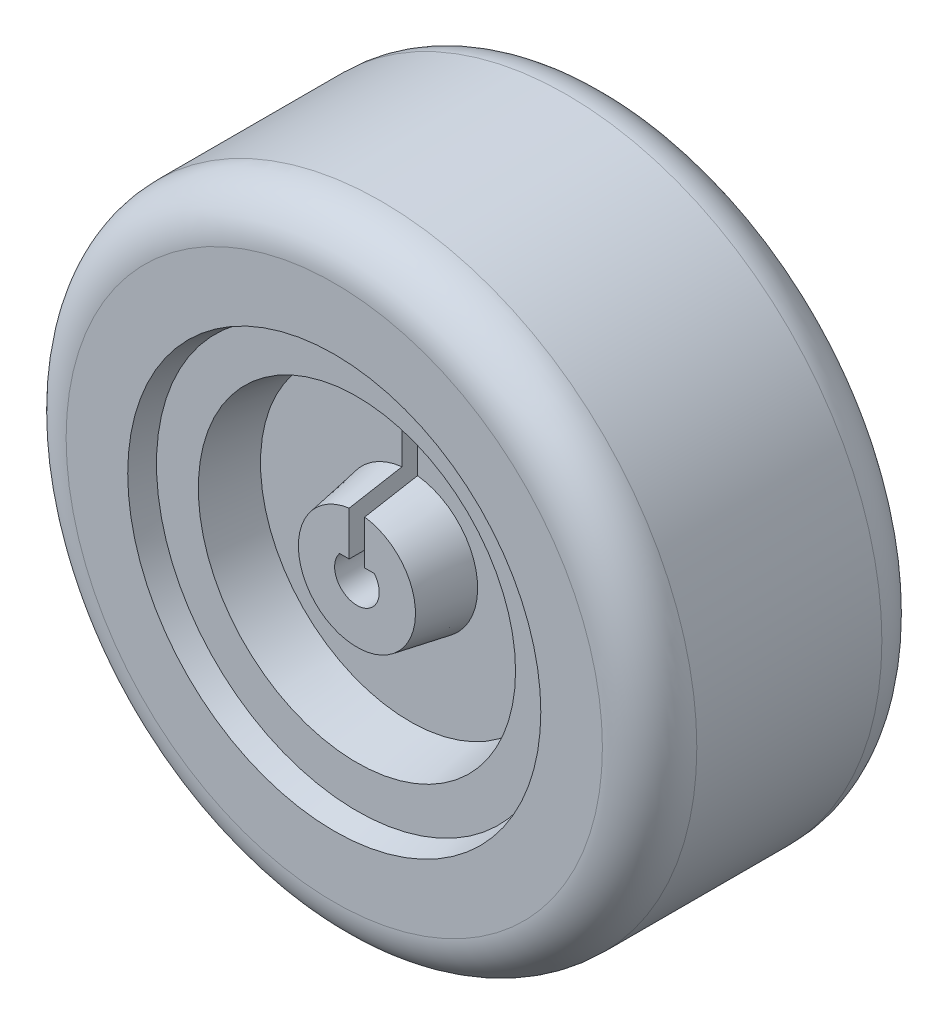
from build123d import *

# Parameters (mm, degrees)
SKETCH1_R           = 21.209
SKETCH1_R_2         = 13.208
BOSS_EXTRUDE1_DEPTH = 18.796
FILLET1_R           = 3.175
BOSS_EXTRUDE2_START = -1.524
SKETCH2_R           = 13.208
BOSS_EXTRUDE2_DEPTH = 15.748
SKETCH4_R           = 10.668
SKETCH4_R_2         = 3.937
CUT_EXTRUDE2_DEPTH  = 3.556
CUT_EXTRUDE2_DRAFT  = -10
SKETCH5_R           = 10.668
CUT_EXTRUDE3_DEPTH  = 9.652
SKETCH6_R           = 4.1275
BOSS_EXTRUDE3_DEPTH = 3.81
BOSS_EXTRUDE3_TAPER = 10
CUT_EXTRUDE1_DEPTH  = 20.32
CHAMFER2_SIZE       = 0.683442603
CHAMFER2_SIZE_2     = 2.54
CHAMFER3_SIZE       = 0.683442603
CHAMFER3_SIZE_2     = 2.54
CUT_EXTRUDE4_DEPTH  = 5.842


with BuildPart() as part:
    # Sketch1 → Boss-Extrude1 (new body)
    with BuildSketch(Plane.XY):
        Circle(SKETCH1_R)
        Circle(SKETCH1_R_2, mode=Mode.SUBTRACT)
    extrude(amount=BOSS_EXTRUDE1_DEPTH)

    # Fillet1
    fillet1_edges = [part.edges().sort_by_distance(p)[0] for p in [
        (-21.209, 0, 0),
        (-21.209, 0, 18.796),
    ]]
    fillet(fillet1_edges, radius=FILLET1_R)



with BuildPart() as body_2:
    # Sketch2 → Boss-Extrude2 (new body)
    with BuildSketch(Plane.XY.offset(18.796).offset(BOSS_EXTRUDE2_START)):
        Circle(SKETCH2_R)
    extrude(amount=-BOSS_EXTRUDE2_DEPTH)


with BuildPart() as cut_extrude2_tool:
    # Sketch4 → Cut-Extrude2 (with draft: the straight prism first)
    with BuildSketch(Plane.XY.offset(17.272)):
        Circle(SKETCH4_R)
        Circle(SKETCH4_R_2, mode=Mode.SUBTRACT)
    extrude(amount=-CUT_EXTRUDE2_DEPTH)
    # Cut-Extrude2: the draft: its side faces are tilted about the plane it starts from
    cut_extrude2_sides = [cut_extrude2_tool.faces().sort_by_distance(p)[0] for p in [
        (-10.668, 0, 15.494),
        (-3.937, 0, 15.494),
    ]]
    draft(cut_extrude2_sides, Plane.XY.offset(17.272), CUT_EXTRUDE2_DRAFT)


with BuildPart() as body_2_1:
    add(body_2.part)

    # Cut-Extrude2: cut by cut_extrude2_tool
    add(cut_extrude2_tool.part, mode=Mode.SUBTRACT)

    # Sketch5 → Cut-Extrude3 (cut)
    with BuildSketch(Plane(origin=(0, 0, 1.524), x_dir=(-1, 0, 0), z_dir=(0, 0, -1))):
        Circle(SKETCH5_R)
    extrude(amount=-CUT_EXTRUDE3_DEPTH, mode=Mode.SUBTRACT)


with BuildPart() as part_1:
    add(part.part)

    add(body_2_1.part)  # Boss-Extrude3 merges body 2
    # Sketch6 → Boss-Extrude3 (add)
    with BuildSketch(Plane(origin=(0, 0, 11.176), x_dir=(-1, 0, 0), z_dir=(0, 0, -1))):
        Circle(SKETCH6_R)
    extrude(amount=BOSS_EXTRUDE3_DEPTH, taper=BOSS_EXTRUDE3_TAPER)

    # Sketch3 → Cut-Extrude1 (cut)
    with BuildSketch(Plane.XY.offset(17.272)):
        with BuildLine():
            Line((-1.17021598, 0.9384), (-0.5207, 0.9384))
            Line((-0.5207, 0.9384), (-0.5207, 6.710804028))
            Line((-0.5207, 6.710804028), (0.5207, 6.710804028))
            Line((0.5207, 6.710804028), (0.5207, 0.9384))
            Line((0.5207, 0.9384), (1.17021598, 0.9384))
            ThreePointArc((1.17021598, 0.9384), (0, -1.5), (-1.17021598, 0.9384))
        make_face()
    extrude(amount=-CUT_EXTRUDE1_DEPTH, mode=Mode.SUBTRACT)

    # Chamfer2
    # the kernel refuses this chamfer: 2.54, 0.683442603 mm, written as the material it takes off along each edge
    with BuildSketch(Plane(origin=(0, 0, 18.796), x_dir=(1, 0, 0), z_dir=(0, -1, 0))) as chamfer2_piece_1_section:
        Polygon((13.208 + CHAMFER2_SIZE, 0), (13.208, -CHAMFER2_SIZE_2), (13.208, 0), align=None)
    chamfer2_piece_1 = revolve(axis=Axis((0, 0, 18.796), (0, 0, 1)), mode=Mode.PRIVATE)
    chamfer2_piece_1 = split(chamfer2_piece_1, bisect_by=Plane(origin=(-13.659448533, 0, 17.272), z_dir=(0, 0, 1)), keep=Keep.TOP, mode=Mode.PRIVATE)
    add(chamfer2_piece_1, mode=Mode.SUBTRACT)

    # Chamfer3
    # the kernel refuses this chamfer: 2.54, 0.683442603 mm, written as the material it takes off along each edge
    with BuildSketch(Plane(origin=(0, 0, 0), x_dir=(1, 0, 0), z_dir=(0, -1, 0))) as chamfer3_piece_1_section:
        Polygon((13.208 + CHAMFER3_SIZE, 0), (13.208, CHAMFER3_SIZE_2), (13.208, 0), align=None)
    chamfer3_piece_1 = revolve(axis=Axis((0, 0, 0), (0, 0, 1)), mode=Mode.PRIVATE)
    chamfer3_piece_1 = split(chamfer3_piece_1, bisect_by=Plane(origin=(-13.659448521, 0, 1.524), z_dir=(0, 0, -1)), keep=Keep.TOP, mode=Mode.PRIVATE)
    add(chamfer3_piece_1, mode=Mode.SUBTRACT)

    # Sketch8 → Cut-Extrude4 (cut)
    with BuildSketch(Plane(origin=(0, 0, 1.524), x_dir=(-1, 0, 0), z_dir=(0, 0, -1))):
        with BuildLine():
            Line((1.931554123, 13.34228712), (0.26745284, 7.131776584))
            Line((0.26745284, 7.131776584), (3.334267338, 6.310026116))
            Line((3.334267338, 6.310026116), (4.998368621, 12.520536652))
            ThreePointArc((4.998368621, 12.520536652), (3.489237132, 13.022010258), (1.931554123, 13.34228712))
        make_face()
        with BuildLine():
            Line((8.343918499, 10.588982529), (3.797509246, 6.042573276))
            Line((3.797509246, 6.042573276), (6.042573276, 3.797509246))
            Line((6.042573276, 3.797509246), (10.588982529, 8.343918499))
            ThreePointArc((10.588982529, 8.343918499), (9.532773125, 9.532773125), (8.343918499, 10.588982529))
        make_face()
        with BuildLine():
            Line((12.520536652, 4.998368621), (6.310026116, 3.334267338))
            Line((6.310026116, 3.334267338), (7.131776584, 0.26745284))
            Line((7.131776584, 0.26745284), (13.34228712, 1.931554123))
            ThreePointArc((13.34228712, 1.931554123), (13.022010258, 3.489237132), (12.520536652, 4.998368621))
        make_face()
        with BuildLine():
            Line((13.34228712, -1.931554123), (7.131776584, -0.26745284))
            Line((7.131776584, -0.26745284), (6.310026116, -3.334267338))
            Line((6.310026116, -3.334267338), (12.520536652, -4.998368621))
            ThreePointArc((12.520536652, -4.998368621), (13.022010258, -3.489237132), (13.34228712, -1.931554123))
        make_face()
        with BuildLine():
            Line((10.588982529, -8.343918499), (6.042573276, -3.797509246))
            Line((6.042573276, -3.797509246), (3.797509246, -6.042573276))
            Line((3.797509246, -6.042573276), (8.343918499, -10.588982529))
            ThreePointArc((8.343918499, -10.588982529), (9.532773125, -9.532773125), (10.588982529, -8.343918499))
        make_face()
        with BuildLine():
            Line((4.998368621, -12.520536652), (3.334267338, -6.310026116))
            Line((3.334267338, -6.310026116), (0.26745284, -7.131776584))
            Line((0.26745284, -7.131776584), (1.931554123, -13.34228712))
            ThreePointArc((1.931554123, -13.34228712), (3.489237132, -13.022010258), (4.998368621, -12.520536652))
        make_face()
        with BuildLine():
            Line((-1.931554123, -13.34228712), (-0.26745284, -7.131776584))
            Line((-0.26745284, -7.131776584), (-3.334267338, -6.310026116))
            Line((-3.334267338, -6.310026116), (-4.998368621, -12.520536652))
            ThreePointArc((-4.998368621, -12.520536652), (-3.489237132, -13.022010258), (-1.931554123, -13.34228712))
        make_face()
        with BuildLine():
            Line((-8.343918499, -10.588982529), (-3.797509246, -6.042573276))
            Line((-3.797509246, -6.042573276), (-6.042573276, -3.797509246))
            Line((-6.042573276, -3.797509246), (-10.588982529, -8.343918499))
            ThreePointArc((-10.588982529, -8.343918499), (-9.532773125, -9.532773125), (-8.343918499, -10.588982529))
        make_face()
        with BuildLine():
            Line((-12.520536652, -4.998368621), (-6.310026116, -3.334267338))
            Line((-6.310026116, -3.334267338), (-7.131776584, -0.26745284))
            Line((-7.131776584, -0.26745284), (-13.34228712, -1.931554123))
            ThreePointArc((-13.34228712, -1.931554123), (-13.022010258, -3.489237132), (-12.520536652, -4.998368621))
        make_face()
        with BuildLine():
            Line((-13.34228712, 1.931554123), (-7.131776584, 0.26745284))
            Line((-7.131776584, 0.26745284), (-6.310026116, 3.334267338))
            Line((-6.310026116, 3.334267338), (-12.520536652, 4.998368621))
            ThreePointArc((-12.520536652, 4.998368621), (-13.022010258, 3.489237132), (-13.34228712, 1.931554123))
        make_face()
        with BuildLine():
            Line((-10.588982529, 8.343918499), (-6.042573276, 3.797509246))
            Line((-6.042573276, 3.797509246), (-3.797509246, 6.042573276))
            Line((-3.797509246, 6.042573276), (-8.343918499, 10.588982529))
            ThreePointArc((-8.343918499, 10.588982529), (-9.532773125, 9.532773125), (-10.588982529, 8.343918499))
        make_face()
        with BuildLine():
            Line((-4.998368621, 12.520536652), (-3.334267338, 6.310026116))
            Line((-3.334267338, 6.310026116), (-0.26745284, 7.131776584))
            Line((-0.26745284, 7.131776584), (-1.931554123, 13.34228712))
            ThreePointArc((-1.931554123, 13.34228712), (-3.489237132, 13.022010258), (-4.998368621, 12.520536652))
        make_face()
    extrude(amount=-CUT_EXTRUDE4_DEPTH, mode=Mode.SUBTRACT)


solid = part_1.part
